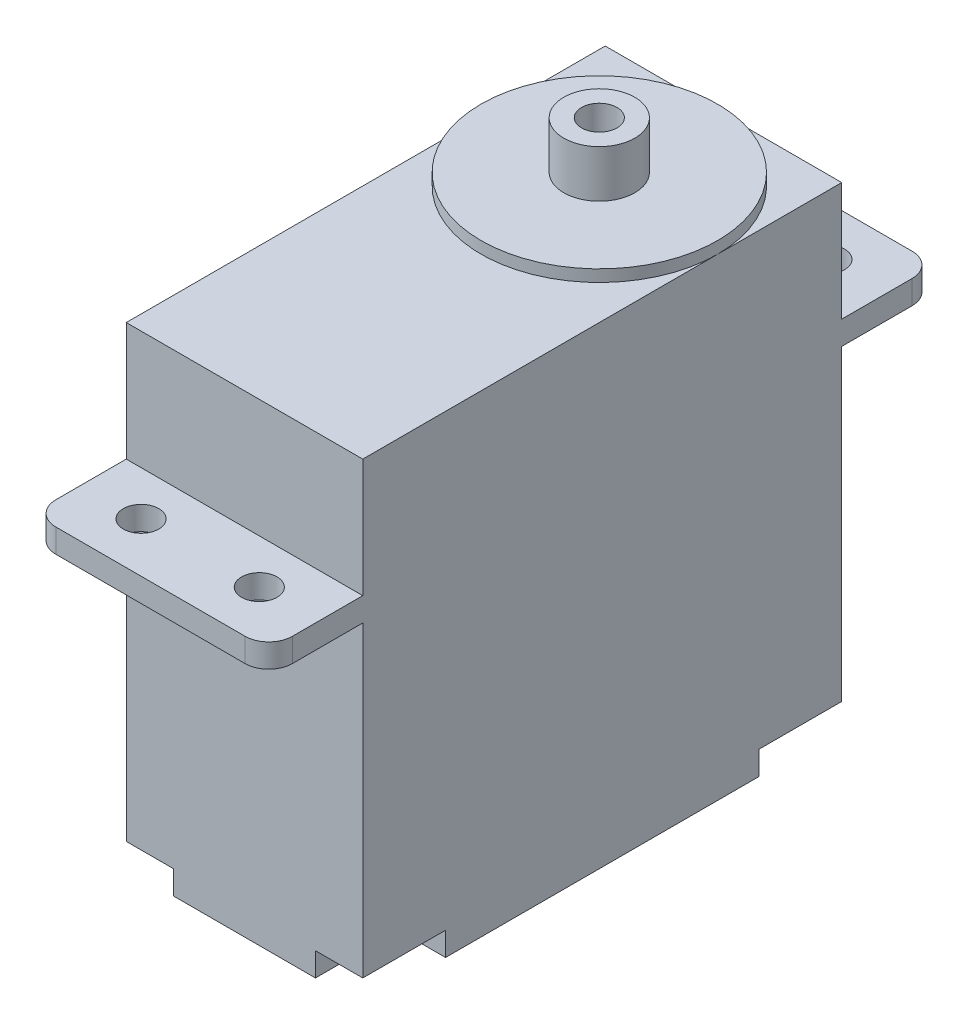
from build123d import *

# Parameters (mm, degrees)
SKETCH2_W           = 20
SKETCH2_H           = 40.5
BOSS_EXTRUDE1_DEPTH = 28
SKETCH3_W           = 20
SKETCH3_H           = 56.4
BOSS_EXTRUDE2_DEPTH = 2
SKETCH4_W           = 20
SKETCH4_H           = 40.5
BOSS_EXTRUDE3_DEPTH = 10
SKETCH5_R           = 10
BOSS_EXTRUDE4_DEPTH = 1
SKETCH6_R           = 3
SKETCH6_R_2         = 1.5
BOSS_EXTRUDE5_DEPTH = 4
SKETCH7_R           = 1.5
CUT_EXTRUDE1_DEPTH  = 2
FILLET1_R           = 2
SKETCH8_W           = 4
SKETCH8_H           = 7
CUT_EXTRUDE2_DEPTH  = 2
SKETCH9_W           = 8
SKETCH9_H           = 3
BOSS_EXTRUDE6_DEPTH = 5


with BuildPart() as part:
    # Sketch2 → Boss-Extrude1 (new body)
    with BuildSketch(Plane(origin=(0, 77, 0), x_dir=(1, 0, 0), z_dir=(0, 1, 0))):
        with Locations((-39.282617367, 276.14521975)):
            Rectangle(SKETCH2_W, SKETCH2_H)
    extrude(amount=BOSS_EXTRUDE1_DEPTH)

    # Sketch3 → Boss-Extrude2 (add)
    with BuildSketch(Plane(origin=(0, 105, 0), x_dir=(1, 0, 0), z_dir=(0, 1, 0))):
        with Locations((-39.282617367, 276.14521975)):
            Rectangle(SKETCH3_W, SKETCH3_H)
    extrude(amount=BOSS_EXTRUDE2_DEPTH)

    # Sketch4 → Boss-Extrude3 (add)
    with BuildSketch(Plane(origin=(0, 107, 0), x_dir=(1, 0, 0), z_dir=(0, 1, 0))):
        with Locations((-39.282617367, 276.14521975)):
            Rectangle(SKETCH4_W, SKETCH4_H)
    extrude(amount=BOSS_EXTRUDE3_DEPTH)

    # Sketch5 → Boss-Extrude4 (add)
    with BuildSketch(Plane(origin=(0, 117, 0), x_dir=(1, 0, 0), z_dir=(0, 1, 0))):
        with Locations((-39.282617367, 285.89521975)):
            Circle(SKETCH5_R)
    extrude(amount=BOSS_EXTRUDE4_DEPTH)

    # Sketch6 → Boss-Extrude5 (add)
    with BuildSketch(Plane(origin=(0, 118, 0), x_dir=(1, 0, 0), z_dir=(0, 1, 0))):
        with Locations((-39.282617367, 285.89521975)):
            Circle(SKETCH6_R)
        with Locations((-39.282617367, 285.89521975)):
            Circle(SKETCH6_R_2, mode=Mode.SUBTRACT)
    extrude(amount=BOSS_EXTRUDE5_DEPTH)

    # Sketch7 → Cut-Extrude1 (cut)
    with BuildSketch(Plane(origin=(0, 107, 0), x_dir=(1, 0, 0), z_dir=(0, 1, 0))):
        with Locations((-44.282617367, 252.14521975)):
            Circle(SKETCH7_R)
        with Locations((-34.282617367, 252.14521975)):
            Circle(SKETCH7_R)
        with Locations((-34.282617367, 300.14521975)):
            Circle(SKETCH7_R)
        with Locations((-44.282617367, 300.14521975)):
            Circle(SKETCH7_R)
    extrude(amount=-CUT_EXTRUDE1_DEPTH, mode=Mode.SUBTRACT)

    # Fillet1
    fillet1_edges = [part.edges().sort_by_distance(p)[0] for p in [
        (-29.282617367, 106, -304.34521975),
        (-49.282617367, 106, -304.34521975),
        (-49.282617367, 106, -247.94521975),
        (-29.282617367, 106, -247.94521975),
    ]]
    fillet(fillet1_edges, radius=FILLET1_R)

    # Sketch8 → Cut-Extrude2 (cut)
    with BuildSketch(Plane.XZ.offset(-77)):
        with Locations((-31.282617367, -259.39521975)):
            Rectangle(SKETCH8_W, SKETCH8_H)
        with Locations((-31.282617367, -292.89521975)):
            Rectangle(SKETCH8_W, SKETCH8_H)
        with Locations((-47.282617367, -292.89521975)):
            Rectangle(SKETCH8_W, SKETCH8_H)
        with Locations((-47.282617367, -259.39521975)):
            Rectangle(SKETCH8_W, SKETCH8_H)
    extrude(amount=-CUT_EXTRUDE2_DEPTH, mode=Mode.SUBTRACT)

    # Sketch9 → Boss-Extrude6 (add)
    with BuildSketch(Plane(origin=(0, 0, -296.39521975), x_dir=(-1, 0, 0), z_dir=(0, 0, -1))):
        with Locations((39.282617367, 78.5)):
            Rectangle(SKETCH9_W, SKETCH9_H)
    extrude(amount=BOSS_EXTRUDE6_DEPTH)


solid = part.part
